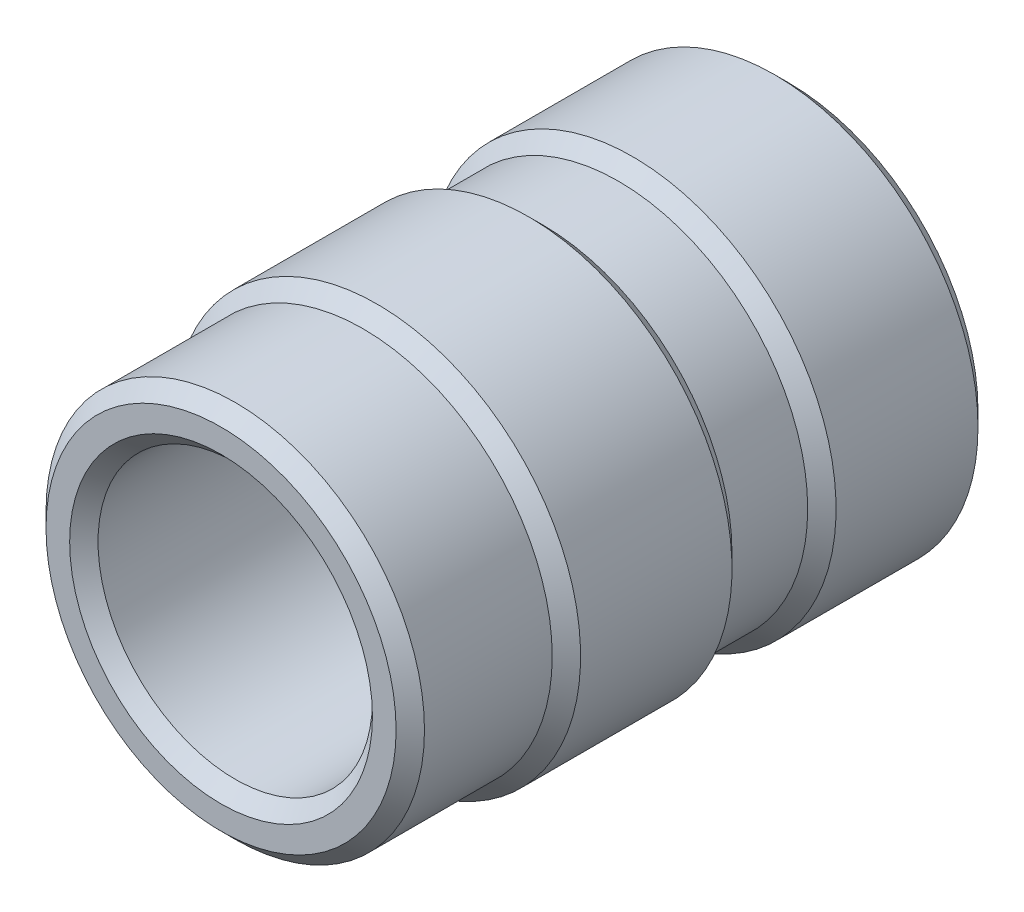
from build123d import *

# Parameters (mm, degrees)
SKIZZE1_R                       = 2
SKIZZE1_R_2                     = 1.45
AUFSATZ_LINEAR_AUSTRAGEN1_DEPTH = 6
SKIZZE2_R                       = 2.15
SKIZZE2_R_2                     = 1.755690243
AUFSATZ_LINEAR_AUSTRAGEN2_DEPTH = 1.8
AUFSATZ_LINEAR_START            = -2.6
SKIZZE2_2_R                     = 2.15
SKIZZE2_2_R_2                   = 1.755690243
AUFSATZ_LINEAR_AUSTRAGEN3_DEPTH = 1.9
FASE1_SIZE                      = 0.15
FASE2_SIZE                      = 0.15


with BuildPart() as part:
    # Skizze1 → Aufsatz-Linear austragen1 (new body)
    with BuildSketch(Plane.XY):
        Circle(SKIZZE1_R)
        Circle(SKIZZE1_R_2, mode=Mode.SUBTRACT)
    extrude(amount=AUFSATZ_LINEAR_AUSTRAGEN1_DEPTH)

    # Skizze2 → Aufsatz-Linear austragen2 (add)
    with BuildSketch(Plane(origin=(0, 0, 0), x_dir=(-1, 0, 0), z_dir=(0, 0, -1))):
        Circle(SKIZZE2_R)
        Circle(SKIZZE2_R_2, mode=Mode.SUBTRACT)
    extrude(amount=-AUFSATZ_LINEAR_AUSTRAGEN2_DEPTH)

    # Skizze2<2> → Aufsatz-Linear austragen3 (add)
    with BuildSketch(Plane(origin=(0, 0, 0), x_dir=(-1, 0, 0), z_dir=(0, 0, -1)).offset(AUFSATZ_LINEAR_START)):
        Circle(SKIZZE2_2_R)
        Circle(SKIZZE2_2_R_2, mode=Mode.SUBTRACT)
    extrude(amount=-AUFSATZ_LINEAR_AUSTRAGEN3_DEPTH)

    # Fase1
    fase1_edges = [part.edges().sort_by_distance(p)[0] for p in [
        (2.15, 0, 0),
        (-2, 0, 6),
        (-1.45, 0, 0),
        (-1.45, 0, 6),
    ]]
    chamfer(fase1_edges, length=FASE1_SIZE)

    # Fase2
    fase2_edges = [part.edges().sort_by_distance(p)[0] for p in [
        (2.15, 0, 1.8),
        (2.15, 0, 4.5),
        (2.15, 0, 2.6),
    ]]
    chamfer(fase2_edges, length=FASE2_SIZE - 0.0001)  # a hair under: the kernel refuses the full size


solid = part.part
